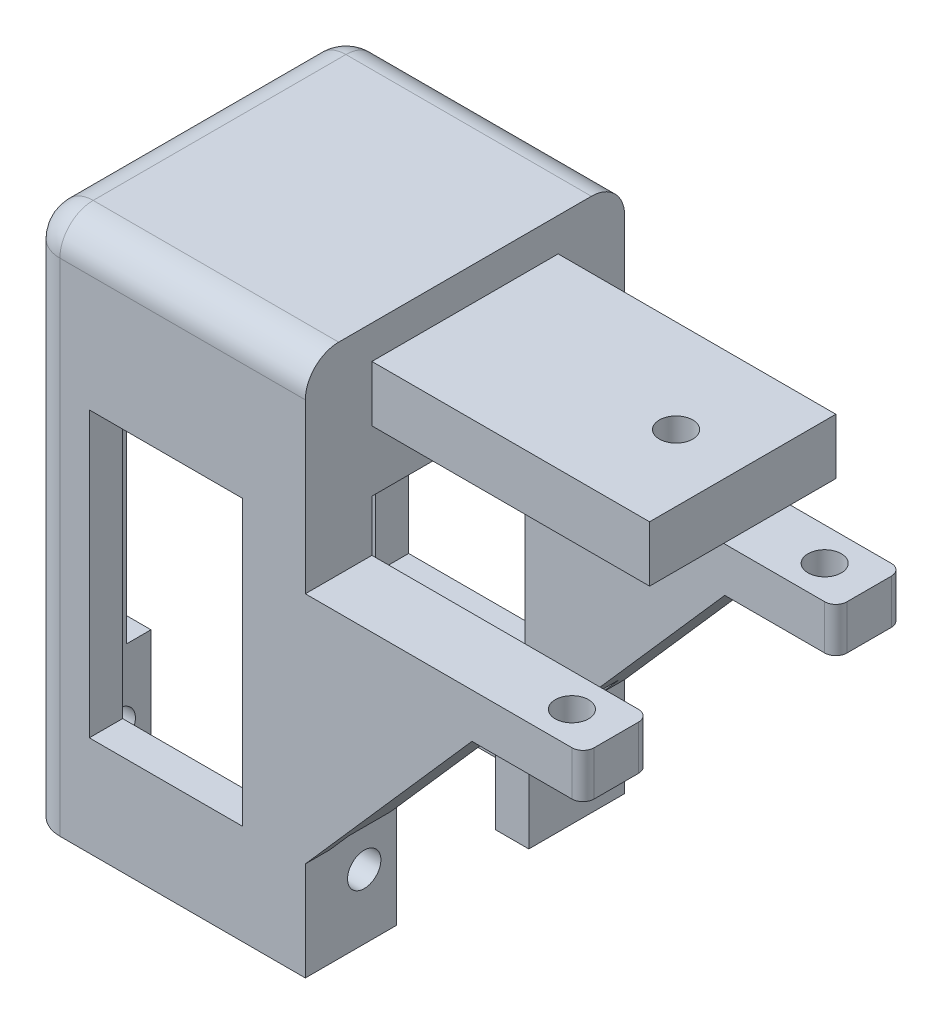
from build123d import *

# Parameters (mm, degrees)
SKETCH4_W            = 25.1
SKETCH4_H            = 28.75
BOSS_EXTRUDE2_DEPTH  = 53
SKETCH5_W            = 19.1
SKETCH5_H            = 22.75
CUT_EXTRUDE1_DEPTH   = 21.67
FILLET1_R            = 4.1
SKETCH6_W            = 5
SKETCH6_H            = 8
CUT_EXTRUDE2_DEPTH   = 4.67
SKETCH7_W            = 16.769550268
SKETCH7_H            = 35.14
CUT_EXTRUDE3_DEPTH   = 40
SKETCH8_W            = 13.798322684
SKETCH8_H            = 35.14
CUT_EXTRUDE4_DEPTH   = 40
BOSS_EXTRUDE3_DEPTH  = 17
SKETCH10_W           = 3
SKETCH10_H           = 9
BOSS_EXTRUDE4_DEPTH  = 13.8
SKETCH11_W           = 3
SKETCH11_H           = 9
BOSS_EXTRUDE5_DEPTH  = 13.8
SKETCH12_W           = 3
SKETCH12_H           = 12
BOSS_EXTRUDE6_DEPTH  = 16.77
SKETCH24_R           = 1.5
CUT_EXTRUDE6_DEPTH   = 40.8
SKETCH25_W           = 28.75
SKETCH25_H           = 21.925089144
CUT_EXTRUDE7_DEPTH   = 40.8
SKETCH26_W           = 11.913987102
SKETCH26_H           = 12
CUT_EXTRUDE8_DEPTH   = 40.8
SKETCH30_W           = 28.75
SKETCH30_H           = 8.02
BOSS_EXTRUDE10_DEPTH = 30
SKETCH32_W           = 5.990224866
SKETCH32_H           = 21.060252184
BOSS_EXTRUDE13_DEPTH = 30
CUT_EXTRUDE9_DEPTH   = 30
SKETCH36_W           = 5
SKETCH36_H           = 28.75
CUT_EXTRUDE10_DEPTH  = 30
SKETCH38_W           = 5.99
SKETCH38_H           = 8.02
CUT_EXTRUDE11_DEPTH  = 25
SKETCH39_R           = 1.5
CUT_EXTRUDE12_DEPTH  = 25
SKETCH40_R           = 1.5
CUT_EXTRUDE13_DEPTH  = 25
FILLET4_R            = 3
FILLET5_R            = 3
FILLET7_R            = 1
SKETCH41_W           = 16.77
SKETCH41_H           = 3
CUT_EXTRUDE14_DEPTH  = 25
CUT_EXTRUDE15_DEPTH  = 3.79
CUT_EXTRUDE16_DEPTH  = 3.79


with BuildPart() as part:
    # Sketch4 → Boss-Extrude2 (new body)
    with BuildSketch(Plane(origin=(0, 0, 0), x_dir=(1, 0, 0), z_dir=(0, 1, 0))):
        Rectangle(SKETCH4_W, SKETCH4_H)
    extrude(amount=BOSS_EXTRUDE2_DEPTH)

    # Sketch5 → Cut-Extrude1 (cut)
    with BuildSketch(Plane(origin=(0, 0, 0), x_dir=(-1, 0, 0), z_dir=(0, -1, 0))):
        Rectangle(SKETCH5_W, SKETCH5_H)
    extrude(amount=-CUT_EXTRUDE1_DEPTH, mode=Mode.SUBTRACT)

    # Fillet1
    fillet1_edges = [part.edges().sort_by_distance(p)[0] for p in [
        (0, 21.67, -11.375),
        (0, 21.67, 11.375),
    ]]
    fillet(fillet1_edges, radius=FILLET1_R)

    # Sketch6 → Cut-Extrude2 (cut)
    with BuildSketch(Plane(origin=(0, 21.67, 0), x_dir=(-1, 0, 0), z_dir=(0, -1, 0))):
        Rectangle(SKETCH6_W, SKETCH6_H)
    extrude(amount=-CUT_EXTRUDE2_DEPTH, mode=Mode.SUBTRACT)

    # Sketch7 → Cut-Extrude3 (cut)
    with BuildSketch(Plane(origin=(12.55, 0, 0), x_dir=(0, 0, -1), z_dir=(1, 0, 0))):
        Rectangle(SKETCH7_W, SKETCH7_H)
    extrude(amount=-CUT_EXTRUDE3_DEPTH, mode=Mode.SUBTRACT)

    # Sketch8 → Cut-Extrude4 (cut)
    with BuildSketch(Plane(origin=(0, 0, -14.375), x_dir=(-1, 0, 0), z_dir=(0, 0, -1))):
        Rectangle(SKETCH8_W, SKETCH8_H)
    extrude(amount=-CUT_EXTRUDE4_DEPTH, mode=Mode.SUBTRACT)

    # Sketch9 → Boss-Extrude3 (add)
    with BuildSketch(Plane.XZ):
        Polygon((-9.55, 8.384775134), (-12.55, 8.384775134), (-12.55, 14.375), (-6.899161342, 14.375), (-6.899161342, 11.375), (-9.55, 11.375), align=None)
        Polygon((-9.55, -8.384775134), (-12.55, -8.384775134), (-12.55, -14.375), (-6.899161342, -14.375), (-6.899161342, -11.375), (-9.55, -11.375), align=None)
        Polygon((6.899161342, -11.375), (6.899161342, -14.375), (12.55, -14.375), (12.55, -8.384775134), (9.55, -8.384775134), (9.55, -11.375), align=None)
        Polygon((9.55, 8.384775134), (12.55, 8.384775134), (12.55, 14.375), (6.899161342, 14.375), (6.899161342, 11.375), (9.55, 11.375), align=None)
    extrude(amount=BOSS_EXTRUDE3_DEPTH)

    # Sketch10 → Boss-Extrude4 (add)
    with BuildSketch(Plane(origin=(-6.899161342, 0, 0), x_dir=(0, 0, -1), z_dir=(1, 0, 0))):
        with Locations((-12.875, -12.5)):
            Rectangle(SKETCH10_W, SKETCH10_H)
    extrude(amount=BOSS_EXTRUDE4_DEPTH)

    # Sketch11 → Boss-Extrude5 (add)
    with BuildSketch(Plane.ZY.offset(-6.899161342)):
        with Locations((-12.875, -12.5)):
            Rectangle(SKETCH11_W, SKETCH11_H)
    extrude(amount=BOSS_EXTRUDE5_DEPTH)

    # Sketch12 → Boss-Extrude6 (add)
    with BuildSketch(Plane.XY.offset(-8.384775134)):
        with Locations((-11.05, -11)):
            Rectangle(SKETCH12_W, SKETCH12_H)
        with Locations((11.05, -11)):
            Rectangle(SKETCH12_W, SKETCH12_H)
    extrude(amount=BOSS_EXTRUDE6_DEPTH)

    # Sketch24 → Cut-Extrude6 (cut)
    with BuildSketch(Plane(origin=(12.55, 0, 0), x_dir=(0, 0, -1), z_dir=(1, 0, 0))):
        with Locations((8.675, -11.18)):
            Circle(SKETCH24_R)
        with Locations((-9.075, -11.18)):
            Circle(SKETCH24_R)
    extrude(amount=-CUT_EXTRUDE6_DEPTH, mode=Mode.SUBTRACT)

    # Sketch25 → Cut-Extrude7 (cut)
    with BuildSketch(Plane.ZY.offset(12.55)):
        with Locations((0, 42.037455428)):
            Rectangle(SKETCH25_W, SKETCH25_H)
    extrude(amount=-CUT_EXTRUDE7_DEPTH, mode=Mode.SUBTRACT)

    # Sketch26 → Cut-Extrude8 (cut)
    with BuildSketch(Plane.ZY.offset(12.55)):
        with Locations((0.21531302, -11)):
            Rectangle(SKETCH26_W, SKETCH26_H)
    extrude(amount=-CUT_EXTRUDE8_DEPTH, mode=Mode.SUBTRACT)

    # Sketch30 → Boss-Extrude10 (add)
    with BuildSketch(Plane(origin=(12.55, 0, 0), x_dir=(0, 0, -1), z_dir=(1, 0, 0))):
        with Locations((0, 27.064910856)):
            Rectangle(SKETCH30_W, SKETCH30_H)
    extrude(amount=BOSS_EXTRUDE10_DEPTH)

    # Sketch32 → Boss-Extrude13 (add)
    with BuildSketch(Plane(origin=(12.55, 0, 0), x_dir=(0, 0, -1), z_dir=(1, 0, 0))):
        with Locations((-11.379887567, 2.424784764)):
            Rectangle(SKETCH32_W, SKETCH32_H)
        with Locations((11.379887567, 2.424784764)):
            Rectangle(SKETCH32_W, SKETCH32_H)
    extrude(amount=BOSS_EXTRUDE13_DEPTH)

    # Sketch35 → Cut-Extrude9 (cut)
    with BuildSketch(Plane(origin=(0, 0, -14.375), x_dir=(-1, 0, 0), z_dir=(0, 0, -1))):
        Polygon((-42.55, 8.954910856), (-27.55, 8.954910856), (-12.55, -8.105341328), (-42.55, -8.105341328), align=None)
    extrude(amount=-CUT_EXTRUDE9_DEPTH, mode=Mode.SUBTRACT)

    # Sketch36 → Cut-Extrude10 (cut)
    with BuildSketch(Plane(origin=(0, 31.074910856, 0), x_dir=(1, 0, 0), z_dir=(0, 1, 0))):
        with Locations((40.05, 0)):
            Rectangle(SKETCH36_W, SKETCH36_H)
    extrude(amount=-CUT_EXTRUDE10_DEPTH, mode=Mode.SUBTRACT)

    # Sketch38 → Cut-Extrude11 (cut)
    with BuildSketch(Plane(origin=(37.55, 0, 0), x_dir=(0, 0, -1), z_dir=(1, 0, 0))):
        with Locations((-11.38, 27.064910856)):
            Rectangle(SKETCH38_W, SKETCH38_H)
        with Locations((11.38, 27.064910856)):
            Rectangle(SKETCH38_W, SKETCH38_H)
    extrude(amount=-CUT_EXTRUDE11_DEPTH, mode=Mode.SUBTRACT)

    # Sketch39 → Cut-Extrude12 (cut)
    with BuildSketch(Plane(origin=(0, 8.954910856, 0), x_dir=(-1, 0, 0), z_dir=(0, -1, 0))):
        with Locations(Location((-33.55, 11.379887567, 0), (0, 0, 90))):
            Circle(SKETCH39_R)
        with Locations(Location((-33.55, -11.379887567, 0), (0, 0, 90))):
            Circle(SKETCH39_R)
    extrude(amount=-CUT_EXTRUDE12_DEPTH, mode=Mode.SUBTRACT)

    # Sketch40 → Cut-Extrude13 (cut)
    with BuildSketch(Plane.XZ.offset(-23.054910856)):
        with Locations(Location((31.55, 0, 0), (0, 0, 270))):
            Circle(SKETCH40_R)
    extrude(amount=-CUT_EXTRUDE13_DEPTH, mode=Mode.SUBTRACT)

    # Fillet4
    fillet4_edges = [part.edges().sort_by_distance(p)[0] for p in [
        (-12.55, 31.074910856, 0),
        (0, 31.074910856, 14.375),
        (0, 31.074910856, -14.375),
    ]]
    fillet(fillet4_edges, radius=FILLET4_R)

    # Fillet5
    # the kernel refuses this fillet: 3 mm, written as the material it takes off along each edge
    with BuildSketch(Plane(origin=(-9.55, 28.074910856, 11.375), x_dir=(0, 0, 1), z_dir=(-1, 0, 0))) as fillet5_piece_1_section:
        Polygon((0, 0), (FILLET5_R, 0), (FILLET5_R, FILLET5_R), (0, FILLET5_R), align=None)
    fillet5_piece_1 = extrude(amount=FILLET5_R, mode=Mode.PRIVATE)
    fillet5_piece_1 = fillet5_piece_1 - Plane(origin=(-9.55, 28.074910856, 11.375), x_dir=(0, -0.7071067811865475, -0.7071067811865475), z_dir=(-1, 0, 0)) * Sphere(FILLET5_R, mode=Mode.PRIVATE)
    add(fillet5_piece_1, mode=Mode.SUBTRACT)
    with BuildSketch(Plane(origin=(-9.55, 28.074910856, -11.375), x_dir=(-1, 0, 0), z_dir=(0, 0, -1))) as fillet5_piece_2_section:
        Polygon((0, 0), (FILLET5_R, 0), (FILLET5_R, FILLET5_R), (0, FILLET5_R), align=None)
    fillet5_piece_2 = extrude(amount=FILLET5_R, mode=Mode.PRIVATE)
    fillet5_piece_2 = fillet5_piece_2 - Plane(origin=(-9.55, 28.074910856, -11.375), x_dir=(0.7071067811865475, -0.7071067811865475, 0), z_dir=(0, 0, -1)) * Sphere(FILLET5_R, mode=Mode.PRIVATE)
    add(fillet5_piece_2, mode=Mode.SUBTRACT)
    with BuildSketch(Plane(origin=(-12.55, 28.074910856, -14.375), x_dir=(1, 0, 0), z_dir=(0, -1, 0))) as fillet5_piece_3:
        with BuildLine():
            CenterArc((FILLET5_R, FILLET5_R), FILLET5_R, 180, 90)
            Line((0, FILLET5_R), (0, 0))
            Line((0, 0), (FILLET5_R, 0))
        make_face()
    extrude(amount=52.574910856, mode=Mode.SUBTRACT)
    with BuildSketch(Plane(origin=(-12.55, -24.5, 14.375), x_dir=(0, 0, -1), z_dir=(0, 1, 0))) as fillet5_piece_4:
        with BuildLine():
            CenterArc((FILLET5_R, -FILLET5_R), FILLET5_R, 90, 90)
            Line((0, -FILLET5_R), (0, 0))
            Line((0, 0), (FILLET5_R, 0))
        make_face()
    extrude(amount=52.574910856, mode=Mode.SUBTRACT)

    # Fillet7
    fillet7_edges = [part.edges().sort_by_distance(p)[0] for p in [
        (37.55, 10.954910856, -14.375),
        (37.55, 10.954910856, -8.384775134),
        (37.55, 10.954910856, 14.375),
        (37.55, 10.954910856, 8.384775134),
    ]]
    fillet(fillet7_edges, radius=FILLET7_R)

    # Sketch41 → Cut-Extrude14 (cut)
    with BuildSketch(Plane(origin=(37.55, 0, 0), x_dir=(0, 0, -1), z_dir=(1, 0, 0))):
        with Locations((0, 29.574910856)):
            Rectangle(SKETCH41_W, SKETCH41_H)
    extrude(amount=-CUT_EXTRUDE14_DEPTH, mode=Mode.SUBTRACT)

    # Sketch43 → Cut-Extrude15 (cut)
    with BuildSketch(Plane(origin=(0, 0, 8.384775134), x_dir=(-1, 0, 0), z_dir=(0, 0, -1))):
        Polygon((-12.55, -8.105341328), (-12.55, -6.175341328), (-14.24692685, -6.175341328), align=None)
    extrude(amount=-CUT_EXTRUDE15_DEPTH, mode=Mode.SUBTRACT)

    # Sketch44 → Cut-Extrude16 (cut)
    with BuildSketch(Plane.XY.offset(-8.384775134)):
        Polygon((12.55, -8.105341328), (12.55, -6.175341328), (14.24692685, -6.175341328), align=None)
    extrude(amount=-CUT_EXTRUDE16_DEPTH, mode=Mode.SUBTRACT)


solid = part.part
